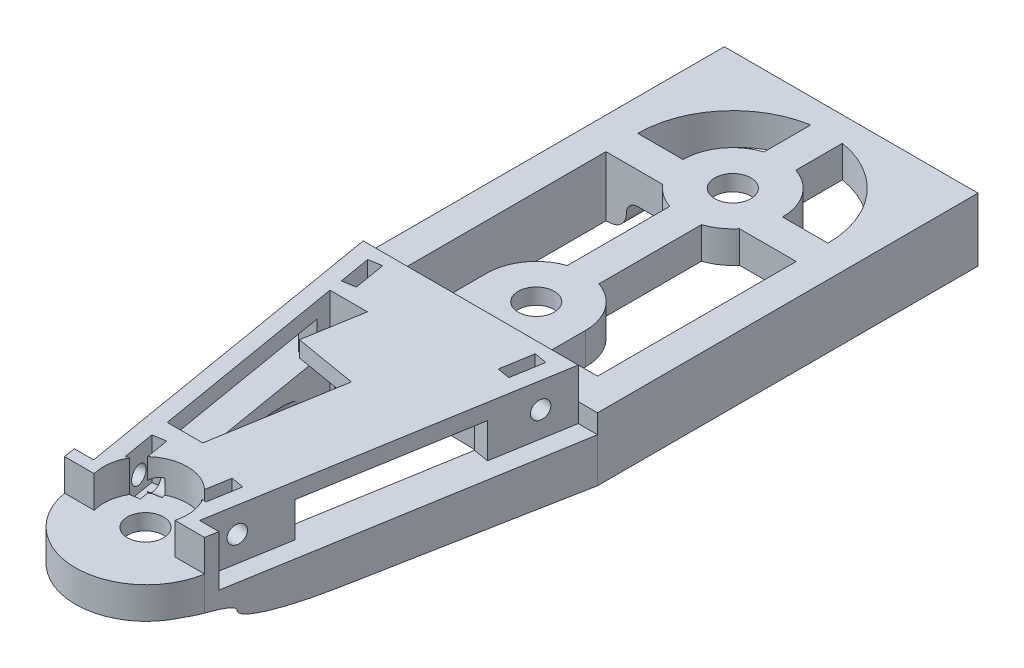
from build123d import *

# Parameters (mm, degrees)
BOSS_EXTRUDE1_DEPTH      = 155.575
SKETCH2_3_R              = 3.6195
CUT_EXTRUDE2_DEPTH       = 88.138
SKETCH2_R                = 3.6195
CUT_EXTRUDE4_DEPTH       = 88.138
SKETCH6_R                = 8.255
CUT_EXTRUDE7_DEPTH       = 3.175
SKETCH6_4_R              = 8.255
CUT_EXTRUDE9_DEPTH       = 3.175
SKETCH11_R               = 3.6195
CUT_EXTRUDE13_DEPTH      = 15.24
CUT_EXTRUDE14_START      = -19.012059749
CUT_EXTRUDE14_DEPTH      = 19.012059749
SKETCH14_R               = 8.255
CUT_EXTRUDE15_DEPTH      = 3.175
CUT_EXTRUDE17_DEPTH      = 10.16
SKETCH17_R               = 1.778
CUT_EXTRUDE18_DEPTH      = 8.05000549
SKETCH18_R               = 1.778
CUT_EXTRUDE19_DEPTH      = 8.05000549
CUT_EXTRUDE20_DEPTH      = 8.2499835
SKETCH22_W               = 50.8
SKETCH22_H               = 6.35
CUT_EXTRUDE21_DEPTH      = 76.2
CUT_EXTRUDE22_DEPTH      = 164.44928659
SKETCH23_6_R             = 8.382
CUT_EXTRUDE24_DEPTH      = 6.35
CUT_EXTRUDE25_START      = -6.35
CUT_EXTRUDE25_DEPTH      = 6.35
CUT_EXTRUDE26_DEPTH      = 33.02
SKETCH26_W               = 33.437341409
SKETCH26_H               = 6.985
CUT_EXTRUDE28_DEPTH      = 12.7
SKETCH27_W               = 33.43734141
SKETCH27_H               = 6.985
CUT_EXTRUDE29_DEPTH      = 12.7
CUT_EXTRUDE30_DEPTH      = 9.525
CUT_EXTRUDE30_DEPTH_BACK = 9.525


# Read off the part's stored shape, not the designer's step: Cut-Extrude14
with BuildPart() as part:
    # Sketch1 → Boss-Extrude1 (new body)
    with BuildSketch(Plane.XY):
        with BuildLine():
            Line((-47.016317908, 7.316908619), (-39.548255563, 8.078908619))
            ThreePointArc((-39.548255563, 8.078908619), (-37.432927088, 9.150659956), (-36.581433223, 11.363853053))
            ThreePointArc((-36.581433223, 11.363853053), (-35.917996307, 12.965531453), (-34.316317908, 13.628968368))
            Line((-34.316317908, 13.628968368), (-8.916317908, 13.628968368))
            ThreePointArc((-8.916317908, 13.628968368), (-7.314639508, 12.965531453), (-6.651202592, 11.363853053))
            ThreePointArc((-6.651202592, 11.363853053), (-5.799708727, 9.150659956), (-3.684380252, 8.078908619))
            Line((-3.684380252, 8.078908619), (3.783682092, 7.316908619))
            Line((3.783682092, 7.316908619), (3.783682092, 26.328968368))
            Line((3.783682092, 26.328968368), (-47.016317908, 26.328968368))
            Line((-47.016317908, 26.328968368), (-47.016317908, 7.316908619))
        make_face()
    extrude(amount=BOSS_EXTRUDE1_DEPTH)

    # Sketch2<3> → Cut-Extrude2 (cut)
    with BuildSketch(Plane(origin=(0, 26.328968368, 0), x_dir=(1, 0, 0), z_dir=(0, 1, 0))):
        with Locations(Location((-21.616317908, -23.7109, 0), (0, 0, 270))):
            Circle(SKETCH2_3_R)
    extrude(amount=-CUT_EXTRUDE2_DEPTH, mode=Mode.SUBTRACT)

    # Sketch2 → Cut-Extrude4 (cut)
    with BuildSketch(Plane(origin=(0, 26.328968368, 0), x_dir=(1, 0, 0), z_dir=(0, 1, 0))):
        with Locations(Location((-21.616317908, -63.0809, 0), (0, 0, 270))):
            Circle(SKETCH2_R)
    extrude(amount=-CUT_EXTRUDE4_DEPTH, mode=Mode.SUBTRACT)

    # Sketch6 → Cut-Extrude7 (cut)
    with BuildSketch(Plane.XZ.offset(-13.628968368)):
        with Locations((-21.616317908, 63.0809)):
            Circle(SKETCH6_R)
    extrude(amount=-CUT_EXTRUDE7_DEPTH, mode=Mode.SUBTRACT)

    # Sketch6<4> → Cut-Extrude9 (cut)
    with BuildSketch(Plane.XZ.offset(-13.628968368)):
        with Locations((-21.616317908, 23.7109)):
            Circle(SKETCH6_4_R)
    extrude(amount=-CUT_EXTRUDE9_DEPTH, mode=Mode.SUBTRACT)

    # Sketch11 → Cut-Extrude13 (cut)
    with BuildSketch(Plane(origin=(0, 26.328968368, 0), x_dir=(1, 0, 0), z_dir=(0, 1, 0))):
        with Locations(Location((-21.616317908, -141.351, 0), (0, 0, 270))):
            Circle(SKETCH11_R)
    extrude(amount=-CUT_EXTRUDE13_DEPTH, mode=Mode.SUBTRACT)

    # Cut-Extrude14 outline → Cut-Extrude14 (cut)
    with BuildSketch(Plane(origin=(0, 26.328968368, 0), x_dir=(1, 0, 0), z_dir=(0, 1, 0)).offset(CUT_EXTRUDE14_START)):
        with BuildLine():
            Line((3.783682092, -155.575), (3.783682092, -76.2))
            Line((3.783682092, -76.2), (-7.591068484, -143.52786157))
            ThreePointArc((-7.591068484, -143.52786157), (-21.616317908, -155.382356431), (-35.641567331, -143.52786157))
            Line((-35.641567331, -143.52786157), (-47.016317908, -76.2))
            Line((-47.016317908, -76.2), (-47.016317908, -155.575))
            Line((-47.016317908, -155.575), (3.783682092, -155.575))
        make_face()
    extrude(amount=CUT_EXTRUDE14_DEPTH, mode=Mode.SUBTRACT)

    # Sketch14 → Cut-Extrude15 (cut)
    with BuildSketch(Plane.XZ.offset(-13.628968368)):
        with Locations(Location((-21.616317908, 141.158356431, 0), (0, 0, 270))):
            Circle(SKETCH14_R)
    extrude(amount=-CUT_EXTRUDE15_DEPTH, mode=Mode.SUBTRACT)

    # Sketch16 → Cut-Extrude17 (cut)
    with BuildSketch(Plane(origin=(0, 26.328968368, 0), x_dir=(1, 0, 0), z_dir=(0, 1, 0))):
        Polygon((-43.152326733, -76.2), (-47.016317908, -76.2), (-36.036339862, -141.191178216), (-32.172348688, -141.191178216), align=None)
        Polygon((-0.080309083, -76.2), (-11.042415805, -141.085396736), (-7.17842463, -141.085396736), (3.783682092, -76.2), align=None)
    extrude(amount=-CUT_EXTRUDE17_DEPTH, mode=Mode.SUBTRACT)

    # Sketch17 → Cut-Extrude18 (cut)
    with BuildSketch(Plane(origin=(12.438328143, 0, 2.101401662), x_dir=(0.16658500693642006, 0, -0.9860270967189456), z_dir=(0.9860270967189456, 0, 0.16658500693642006))):
        with Locations((-134.418525417, 21.248968368)):
            Circle(SKETCH17_R)
        with Locations((-81.683642689, 21.248968368)):
            Circle(SKETCH17_R)
    extrude(amount=-CUT_EXTRUDE18_DEPTH, mode=Mode.SUBTRACT)

    # Sketch18 → Cut-Extrude19 (cut)
    with BuildSketch(Plane(origin=(-54.471233908, 0, 9.202679022), x_dir=(0.16658500693642025, 0, 0.9860270967189457), z_dir=(-0.9860270967189457, 0, 0.16658500693642025))):
        with Locations((74.481733752, 21.248968368)):
            Circle(SKETCH18_R)
        with Locations((127.250236979, 21.248968368)):
            Circle(SKETCH18_R)
    extrude(amount=-CUT_EXTRUDE19_DEPTH, mode=Mode.SUBTRACT)

    # Sketch20 → Cut-Extrude20 (cut)
    with BuildSketch(Plane(origin=(0, 26.328968368, 0), x_dir=(1, 0, 0), z_dir=(0, 1, 0))):
        Polygon((-16.182390778, -136.842276584), (-13.618725454, -137.275396736), (-12.54592046, -130.925396736), (-15.109585784, -130.492276584), align=None)
        Polygon((-30.668844033, -131.031178216), (-28.105178709, -130.598058064), (-27.032373714, -136.948058064), (-29.596039038, -137.381178216), align=None)
        Polygon((-36.896634565, -78.560879848), (-35.823829571, -84.910879848), (-38.387494895, -85.344), (-39.460299889, -78.994), align=None)
        Polygon((-4.84514092, -85.344), (-3.772335926, -78.994), (-6.33600125, -78.560879848), (-7.408806245, -84.910879848), align=None)
    extrude(amount=-CUT_EXTRUDE20_DEPTH, mode=Mode.SUBTRACT)

    # Sketch22 → Cut-Extrude21 (cut)
    with BuildSketch(Plane(origin=(0, 0, 0), x_dir=(-1, 0, 0), z_dir=(0, 0, -1))):
        with Locations((21.616317908, 23.153968368)):
            Rectangle(SKETCH22_W, SKETCH22_H)
    extrude(amount=-CUT_EXTRUDE21_DEPTH, mode=Mode.SUBTRACT)

    # Sketch23 → Cut-Extrude22 (cut, through all)
    with BuildSketch(Plane(origin=(0, 26.328968368, 0), x_dir=(1, 0, 0), z_dir=(0, 1, 0))):
        Polygon((-32.392059675, -99.7331), (-30.424312281, -88.085879848), (-37.924266171, -88.085879848), (-31.296291626, -127.317276584), (-24.172316243, -127.317276584), (-19.869515547, -101.848729588), align=None)
    extrude(amount=-CUT_EXTRUDE22_DEPTH, mode=Mode.SUBTRACT)

    # Sketch23<6> → Cut-Extrude24 (cut)
    with BuildSketch(Plane(origin=(0, 26.328968368, 0), x_dir=(1, 0, 0), z_dir=(0, 1, 0))):
        with Locations((-21.616317908, -141.351)):
            Circle(SKETCH23_6_R)
    extrude(amount=-CUT_EXTRUDE24_DEPTH, mode=Mode.SUBTRACT)

    # Sketch23<8> → Cut-Extrude25 (cut)
    with BuildSketch(Plane(origin=(0, 26.328968368, 0), x_dir=(1, 0, 0), z_dir=(0, 1, 0)).offset(CUT_EXTRUDE25_START)):
        with BuildLine():
            Line((-7.591068484, -143.52786157), (-35.641567331, -143.52786157))
            ThreePointArc((-35.641567331, -143.52786157), (-21.616317908, -155.382356431), (-7.591068484, -143.52786157))
        make_face()
    extrude(amount=CUT_EXTRUDE25_DEPTH, mode=Mode.SUBTRACT)

    # Sketch24 → Cut-Extrude26 (cut)
    with BuildSketch(Plane(origin=(0, 19.978968368, 0), x_dir=(1, 0, 0), z_dir=(0, 1, 0))):
        with BuildLine():
            ThreePointArc((-31.585817908, -23.7109), (-29.710886851, -17.89120208), (-24.791317908, -14.260487033))
            Line((-24.791317908, -14.260487033), (-24.791317908, -4.927346689))
            ThreePointArc((-24.791317908, -4.927346689), (-36.165995739, -11.414177876), (-40.666317908, -23.7109))
            Line((-40.666317908, -23.7109), (-31.585817908, -23.7109))
        make_face()
        with BuildLine():
            Line((-11.646817908, -23.7109), (-2.566317908, -23.7109))
            ThreePointArc((-2.566317908, -23.7109), (-7.066640076, -11.414177876), (-18.441317908, -4.927346689))
            Line((-18.441317908, -4.927346689), (-18.441317908, -14.260487033))
            ThreePointArc((-18.441317908, -14.260487033), (-13.521748964, -17.89120208), (-11.646817908, -23.7109))
        make_face()
        with BuildLine():
            Line((-40.666317908, -30.0609), (-40.666317908, -34.8869))
            Line((-40.666317908, -34.8869), (-40.666317908, -53.250747658))
            Line((-40.666317908, -53.250747658), (-40.666317908, -69.85))
            Line((-40.666317908, -69.85), (-31.522317908, -69.85))
            Line((-31.522317908, -69.85), (-31.522317908, -63.0809))
            ThreePointArc((-31.522317908, -63.0809), (-29.665553461, -57.306937496), (-24.791317908, -53.697499177))
            Line((-24.791317908, -53.697499177), (-24.791317908, -34.8869))
            Line((-24.791317908, -34.8869), (-24.791317908, -33.161312967))
            ThreePointArc((-24.791317908, -33.161312967), (-27.263555479, -31.926716336), (-29.301916794, -30.0609))
            Line((-29.301916794, -30.0609), (-40.666317908, -30.0609))
        make_face()
        with BuildLine():
            Line((-2.566317908, -69.85), (-2.566317908, -53.250747658))
            Line((-2.566317908, -53.250747658), (-2.566317908, -34.8869))
            Line((-2.566317908, -34.8869), (-2.566317908, -30.0609))
            Line((-2.566317908, -30.0609), (-13.930719021, -30.0609))
            ThreePointArc((-13.930719021, -30.0609), (-15.969080336, -31.926716336), (-18.441317908, -33.161312967))
            Line((-18.441317908, -33.161312967), (-18.441317908, -34.8869))
            Line((-18.441317908, -34.8869), (-18.441317908, -53.697499177))
            ThreePointArc((-18.441317908, -53.697499177), (-13.567082354, -57.306937496), (-11.710317908, -63.0809))
            Line((-11.710317908, -63.0809), (-11.710317908, -69.85))
            Line((-11.710317908, -69.85), (-2.566317908, -69.85))
        make_face()
    extrude(amount=-CUT_EXTRUDE26_DEPTH, mode=Mode.SUBTRACT)

    # Sketch26 → Cut-Extrude28 (cut)
    with BuildSketch(Plane(origin=(12.438328143, 0, 2.101401662), x_dir=(0.16658500693642, 0, -0.9860270967189456), z_dir=(0.9860270967189456, 0, 0.16658500693642))):
        with Locations((-107.633029867, 19.661468368)):
            Rectangle(SKETCH26_W, SKETCH26_H)
    extrude(amount=-CUT_EXTRUDE28_DEPTH, mode=Mode.SUBTRACT)

    # Sketch27 → Cut-Extrude29 (cut)
    with BuildSketch(Plane(origin=(-54.471233908, 0, 9.202679022), x_dir=(0.16658500693642025, 0, 0.9860270967189457), z_dir=(-0.9860270967189457, 0, 0.16658500693642025))):
        with Locations((100.43112093, 19.661468368)):
            Rectangle(SKETCH27_W, SKETCH27_H)
    extrude(amount=-CUT_EXTRUDE29_DEPTH, mode=Mode.SUBTRACT)

    # Sketch31 → Cut-Extrude30 (cut, two sides: drawn at the far end of the back side and taken through both)
    with BuildSketch(Plane.XZ.offset(-13.628968368).offset(-CUT_EXTRUDE30_DEPTH_BACK)):
        Polygon((-24.172316243, 127.317276584), (-11.936377908, 127.317276584), (-5.399752892, 88.626583433), (-30.424312281, 88.085879848), (-32.392059675, 99.7331), (-19.869515547, 101.848729588), align=None)
    extrude(amount=CUT_EXTRUDE30_DEPTH + CUT_EXTRUDE30_DEPTH_BACK, mode=Mode.SUBTRACT)


solid = part.part
